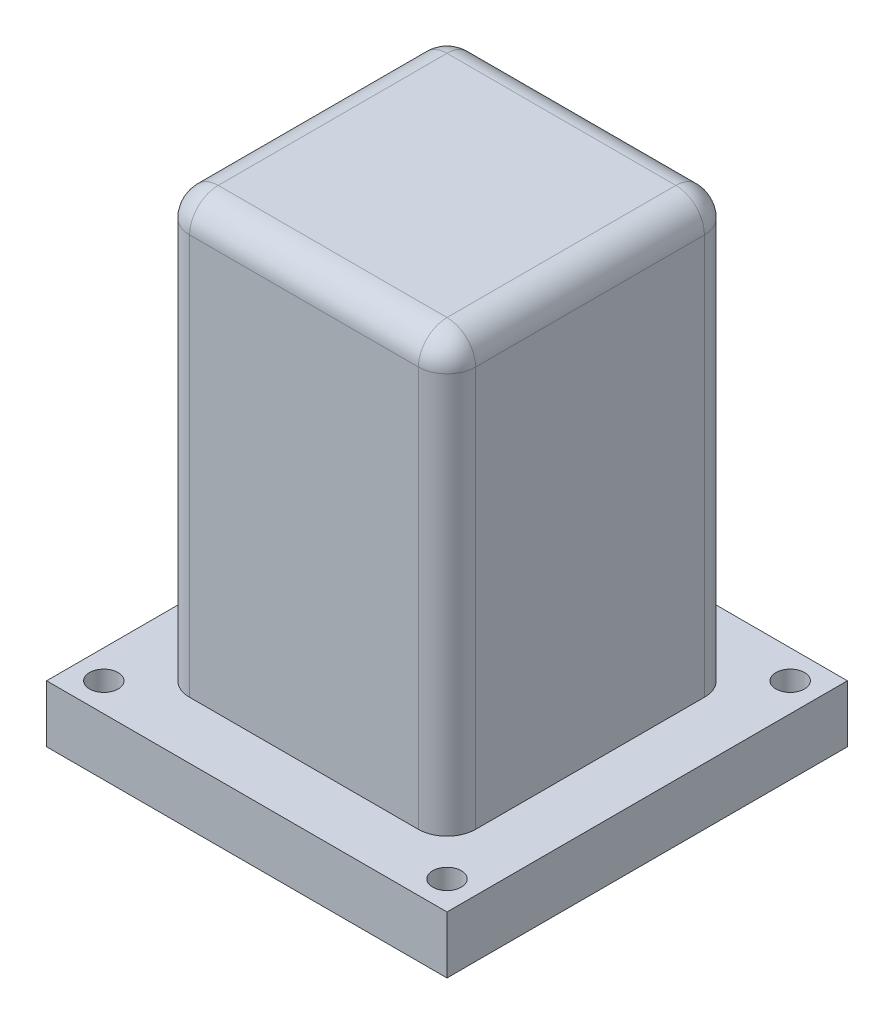
from build123d import *

# Parameters (mm, degrees)
SKETCH1_W           = 50
SKETCH1_H           = 50
BOSS_EXTRUDE1_DEPTH = 85
SKETCH2_R           = 5
BOSS_EXTRUDE2_DEPTH = 30
FILLET1_R           = 5
FILLET2_R           = 5
SKETCH3_W           = 70
SKETCH3_H           = 70
BOSS_EXTRUDE3_DEPTH = 10
FILLET3_R           = 5
SKETCH4_R           = 2.5
CUT_EXTRUDE1_DEPTH  = 10


with BuildPart() as part:
    # Sketch1 → Boss-Extrude1 (new body)
    with BuildSketch(Plane(origin=(0, 0, 0), x_dir=(1, 0, 0), z_dir=(0, 1, 0))):
        Rectangle(SKETCH1_W, SKETCH1_H)
    extrude(amount=BOSS_EXTRUDE1_DEPTH)

    # Sketch2 → Boss-Extrude2 (add)
    with BuildSketch(Plane.XZ):
        with Locations(Location((0, 0, 0), (0, 0, 90))):
            Circle(SKETCH2_R)
    extrude(amount=BOSS_EXTRUDE2_DEPTH)

    # Fillet1
    fillet1_edges = [part.edges().sort_by_distance(p)[0] for p in [
        (0, 85, 25),
        (0, 0, 25),
        (25, 42.5, 25),
        (-25, 42.5, 25),
    ]]
    fillet(fillet1_edges, radius=FILLET1_R)

    # Fillet2
    # the kernel refuses this fillet: 5 mm, written as the material it takes off along each edge
    with BuildSketch(Plane(origin=(-20, 80, 20), x_dir=(0, 1, 0), z_dir=(-1, 0, 0))) as fillet2_piece_1_section:
        Polygon((0, 0), (FILLET2_R, 0), (FILLET2_R, -FILLET2_R), (0, -FILLET2_R), align=None)
    fillet2_piece_1 = extrude(amount=FILLET2_R, mode=Mode.PRIVATE)
    fillet2_piece_1 = fillet2_piece_1 - Plane(origin=(-20, 80, 20), x_dir=(0, -0.7071067811865475, -0.7071067811865475), z_dir=(-1, 0, 0)) * Sphere(FILLET2_R, mode=Mode.PRIVATE)
    add(fillet2_piece_1, mode=Mode.SUBTRACT)
    with BuildSketch(Plane(origin=(20, 80, 20), x_dir=(1, 0, 0), z_dir=(0, 1, 0))) as fillet2_piece_2_section:
        Polygon((0, 0), (FILLET2_R, 0), (FILLET2_R, -FILLET2_R), (0, -FILLET2_R), align=None)
    fillet2_piece_2 = extrude(amount=FILLET2_R, mode=Mode.PRIVATE)
    fillet2_piece_2 = fillet2_piece_2 - Plane(origin=(20, 80, 20), x_dir=(-0.7071067811865475, 0, -0.7071067811865475), z_dir=(0, 1, 0)) * Sphere(FILLET2_R, mode=Mode.PRIVATE)
    add(fillet2_piece_2, mode=Mode.SUBTRACT)
    with BuildSketch(Plane(origin=(-20, 5, 20), x_dir=(0, -1, 0), z_dir=(-1, 0, 0))) as fillet2_piece_3_section:
        Polygon((0, 0), (FILLET2_R, 0), (FILLET2_R, FILLET2_R), (0, FILLET2_R), align=None)
    fillet2_piece_3 = extrude(amount=FILLET2_R, mode=Mode.PRIVATE)
    fillet2_piece_3 = fillet2_piece_3 - Plane(origin=(-20, 5, 20), x_dir=(0, 0.7071067811865475, -0.7071067811865475), z_dir=(-1, 0, 0)) * Sphere(FILLET2_R, mode=Mode.PRIVATE)
    add(fillet2_piece_3, mode=Mode.SUBTRACT)
    with BuildSketch(Plane(origin=(20, 5, 20), x_dir=(1, 0, 0), z_dir=(0, -1, 0))) as fillet2_piece_4_section:
        Polygon((0, 0), (FILLET2_R, 0), (FILLET2_R, FILLET2_R), (0, FILLET2_R), align=None)
    fillet2_piece_4 = extrude(amount=FILLET2_R, mode=Mode.PRIVATE)
    fillet2_piece_4 = fillet2_piece_4 - Plane(origin=(20, 5, 20), x_dir=(-0.7071067811865475, 0, -0.7071067811865475), z_dir=(0, -1, 0)) * Sphere(FILLET2_R, mode=Mode.PRIVATE)
    add(fillet2_piece_4, mode=Mode.SUBTRACT)
    with BuildSketch(Plane(origin=(-25, 85, 20), x_dir=(0, -1, 0), z_dir=(0, 0, -1)), Plane(origin=(25, 0, -37.5), x_dir=(-1, 0, 0), z_dir=(0, 0, 1))) as fillet2_piece_5:
        with BuildLine():
            CenterArc((FILLET2_R, -FILLET2_R), FILLET2_R, 90, 90)
            Line((0, -FILLET2_R), (0, 0))
            Line((0, 0), (FILLET2_R, 0))
        make_face()
    extrude(amount=57.5, mode=Mode.SUBTRACT)
    with BuildSketch(Plane(origin=(25, 85, -37.5), x_dir=(-1, 0, 0), z_dir=(0, 0, 1)), Plane(origin=(-25, 0, 20), x_dir=(0, 1, 0), z_dir=(0, 0, -1))) as fillet2_piece_6:
        with BuildLine():
            CenterArc((FILLET2_R, FILLET2_R), FILLET2_R, 180, 90)
            Line((0, FILLET2_R), (0, 0))
            Line((0, 0), (FILLET2_R, 0))
        make_face()
    extrude(amount=57.5, mode=Mode.SUBTRACT)

    # Sketch3 → Boss-Extrude3 (add)
    with BuildSketch(Plane.XZ):
        Rectangle(SKETCH3_W, SKETCH3_H)
    extrude(amount=-BOSS_EXTRUDE3_DEPTH)

    # Fillet3
    fillet3_edges = [part.edges().sort_by_distance(p)[0] for p in [
        (0, 85, -25),
        (-25, 45, -25),
        (25, 45, -25),
        (23.535533906, 83.535533906, -25),
        (-23.535533906, 83.535533906, -25),
    ]]
    fillet(fillet3_edges, radius=FILLET3_R)

    # Sketch4 → Cut-Extrude1 (cut)
    with BuildSketch(Plane.XZ):
        with Locations(Location((-30, 30, 0), (0, 0, 270))):
            Circle(SKETCH4_R)
        with Locations(Location((30, 30, 0), (0, 0, 270))):
            Circle(SKETCH4_R)
        with Locations(Location((30, -30, 0), (0, 0, 270))):
            Circle(SKETCH4_R)
        with Locations(Location((-30, -30, 0), (0, 0, 270))):
            Circle(SKETCH4_R)
    extrude(amount=-CUT_EXTRUDE1_DEPTH, mode=Mode.SUBTRACT)


solid = part.part
